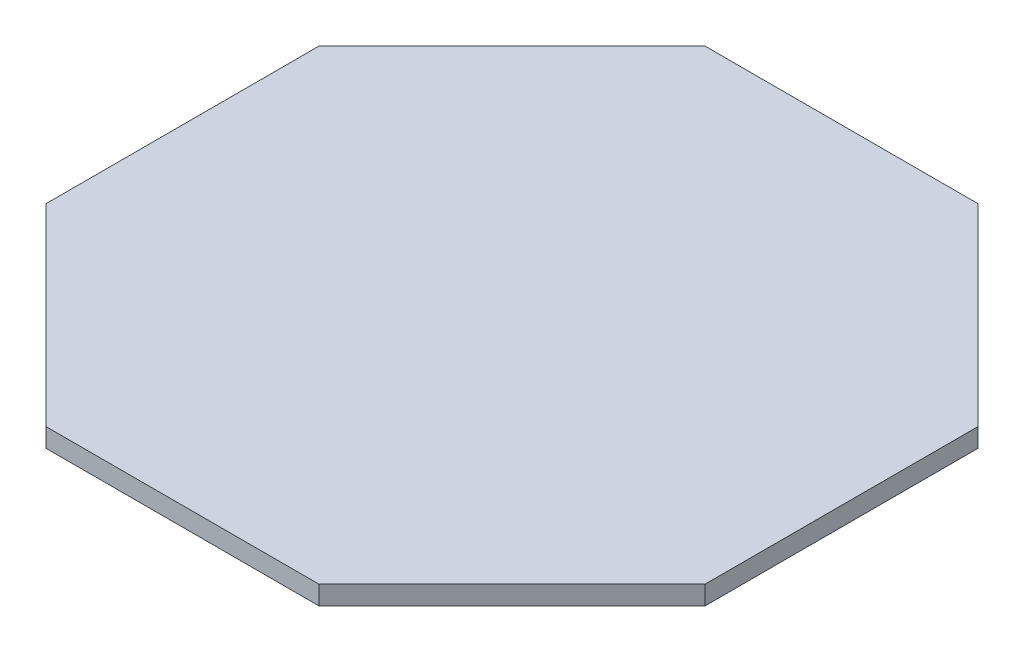
from build123d import *

# Parameters (mm, degrees)
BOSS_EXTRUDE1_DEPTH = 2


with BuildPart() as part:
    # Sketch1 → Boss-Extrude1 (new body)
    with BuildSketch(Plane(origin=(0, 0, 0), x_dir=(1, 0, 0), z_dir=(0, 1, 0))):
        Polygon((35, 14.497474683), (14.497474683, 35), (-14.497474683, 35), (-35, 14.497474683), (-35, -14.497474683), (-14.497474683, -35), (14.497474683, -35), (35, -14.497474683), align=None)
    extrude(amount=BOSS_EXTRUDE1_DEPTH)


solid = part.part
